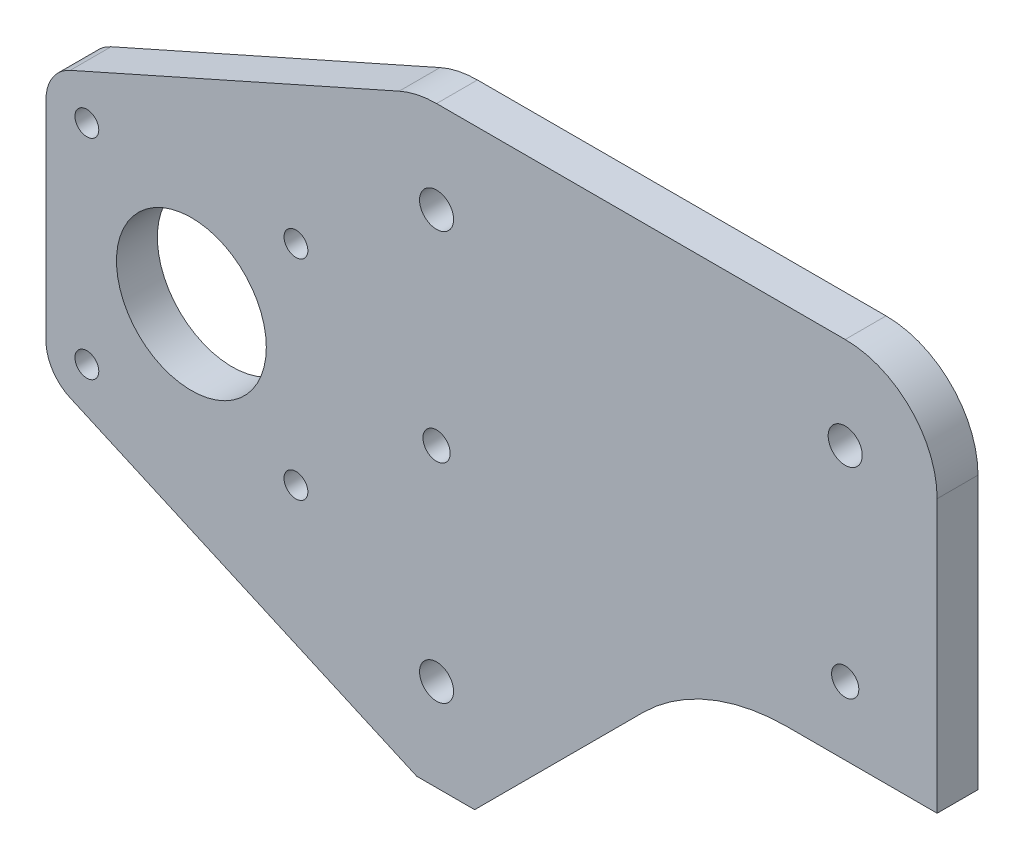
from build123d import *

# Parameters (mm, degrees)
ESBO_O1_R                = 2.5
ESBO_O1_R_2              = 1.75
ESBO_O1_R_3              = 11
ESBO_O1_R_4              = 2
RESSALTO_EXTRUS_O1_DEPTH = 6


with BuildPart() as part:
    # Esboço1 → Ressalto-extrusão1 (new body)
    with BuildSketch(Plane.XY):
        with BuildLine():
            Line((-24.408116908, -43.5), (0.305086528, -18.786796564))
            ThreePointArc((0.305086528, -18.786796564), (10.037786992, -12.283614025), (21.518289963, -10))
            Line((21.518289963, -10), (43.5, -10))
            Line((43.5, -10), (43.5, 30))
            ThreePointArc((43.5, 30), (39.545941546, 39.545941546), (30, 43.5))
            Line((30, 43.5), (-30, 43.5))
            ThreePointArc((-30, 43.5), (-32.806645915, 43.205027024), (-35.490642246, 42.332998327))
            Line((-35.490642246, 42.332998327), (-83.789384737, 20.830431884))
            ThreePointArc((-83.789384737, 20.830431884), (-86.381082634, 18.616995204), (-87.349099295, 15.349099295))
            Line((-87.349099295, 15.349099295), (-87.349099295, -15.349099295))
            ThreePointArc((-87.349099295, -15.349099295), (-86.38174248, -18.615978933), (-83.791598437, -20.829445811))
            Line((-83.791598437, -20.829445811), (-32.924643971, -43.5))
            Line((-32.924643971, -43.5), (-24.408116908, -43.5))
        make_face()
        with Locations((-30, 30)):
            Circle(ESBO_O1_R, mode=Mode.SUBTRACT)
        with Locations((-30, -30)):
            Circle(ESBO_O1_R, mode=Mode.SUBTRACT)
        with Locations((30, 30)):
            Circle(ESBO_O1_R, mode=Mode.SUBTRACT)
        with Locations((-81.349099295, 15.349099295)):
            Circle(ESBO_O1_R_2, mode=Mode.SUBTRACT)
        with Locations((-50.650900705, 15.349099295)):
            Circle(ESBO_O1_R_2, mode=Mode.SUBTRACT)
        with Locations((-50.650900705, -15.349099295)):
            Circle(ESBO_O1_R_2, mode=Mode.SUBTRACT)
        with Locations((-81.349099295, -15.349099295)):
            Circle(ESBO_O1_R_2, mode=Mode.SUBTRACT)
        with Locations((-66, 0)):
            Circle(ESBO_O1_R_3, mode=Mode.SUBTRACT)
        with Locations((-30, 0)):
            Circle(ESBO_O1_R_4, mode=Mode.SUBTRACT)
        with Locations((30, 0)):
            Circle(ESBO_O1_R_4, mode=Mode.SUBTRACT)
    extrude(amount=RESSALTO_EXTRUS_O1_DEPTH)


solid = part.part
